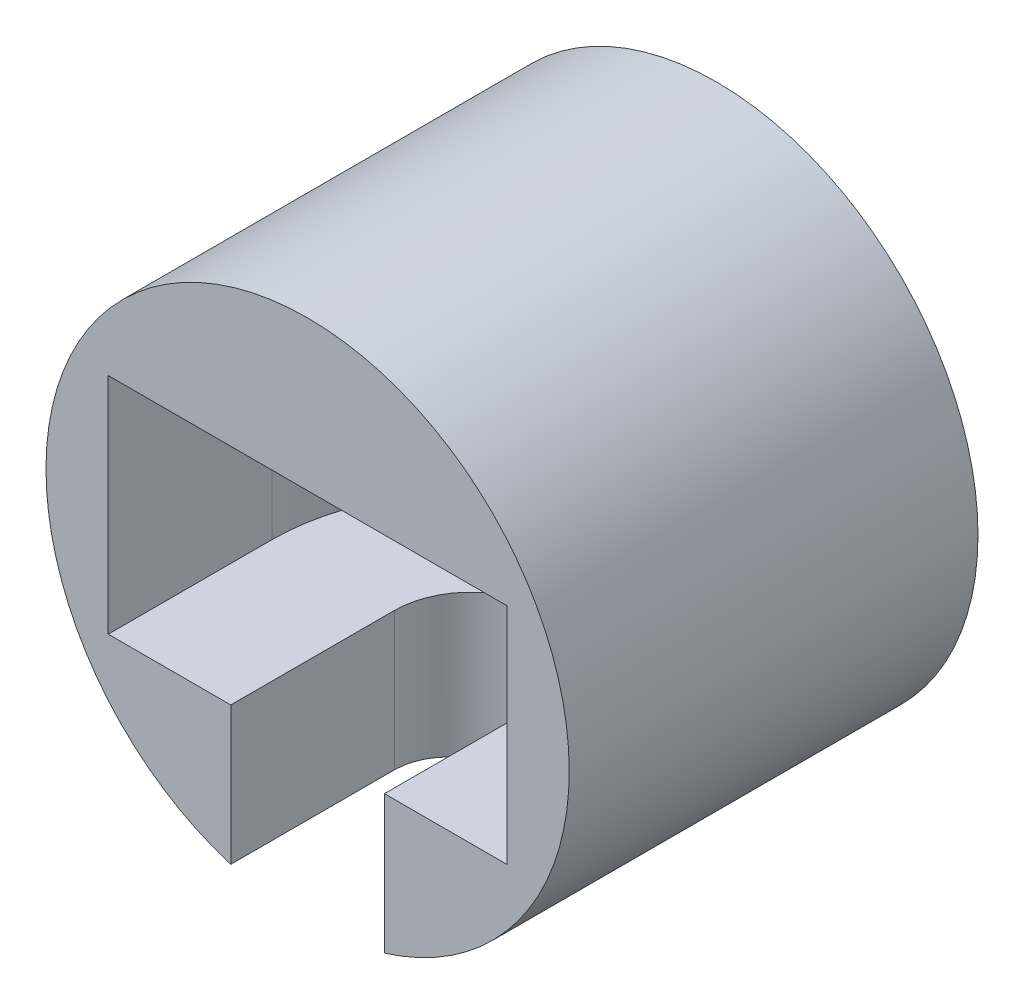
from build123d import *

# Parameters (mm, degrees)
SKETCH1_R               = 16
SKETCH1_R_2             = 3
BOSS_EXTRUDE1_DEPTH     = 25
CUT_EXTRUDE1_DEPTH      = 6.85
CUT_EXTRUDE2_REACH      = 35.719
CUT_EXTRUDE2_END_RADIUS = 16


with BuildPart() as part:
    # Sketch1 → Boss-Extrude1 (new body)
    with BuildSketch(Plane.XY):
        Circle(SKETCH1_R)
        Circle(SKETCH1_R_2, mode=Mode.SUBTRACT)
    extrude(amount=BOSS_EXTRUDE1_DEPTH)

    # Sketch2 → Cut-Extrude1 (cut, symmetric)
    with BuildSketch(Plane(origin=(0, 0, 0), x_dir=(1, 0, 0), z_dir=(0, 1, 0))):
        with BuildLine():
            Line((-12.19297317, -25), (12.19297317, -25))
            Line((12.19297317, -25), (12.19297317, -15))
            ThreePointArc((12.19297317, -15), (0, -2.80702683), (-12.19297317, -15))
            Line((-12.19297317, -15), (-12.19297317, -25))
        make_face()
    extrude(amount=CUT_EXTRUDE1_DEPTH, both=True, mode=Mode.SUBTRACT)

    # Cut-Extrude2: up to this cylinder (the profile starts inside it)
    cut_extrude2_end = Plane(origin=(0, 0, 18.114127), z_dir=(0, 0, -1)) * Cylinder(CUT_EXTRUDE2_END_RADIUS, 104.438, mode=Mode.PRIVATE)
    # Sketch3 → Cut-Extrude2 (cut, up to the surface)
    with BuildSketch(Plane(origin=(0, 0, 0), x_dir=(1, 0, 0), z_dir=(0, 1, 0)), mode=Mode.PRIVATE) as cut_extrude2_sk1:
        with BuildLine():
            Line((-4.7, -15), (-4.7, -25))
            Line((-4.7, -25), (4.7, -25))
            Line((4.7, -25), (4.7, -15))
            ThreePointArc((4.7, -15), (0, -10.3), (-4.7, -15))
        make_face()
    cut_extrude2_tool1 = extrude(cut_extrude2_sk1.sketch, amount=-CUT_EXTRUDE2_REACH, mode=Mode.PRIVATE) & cut_extrude2_end
    add(cut_extrude2_tool1.solids().sort_by_distance((0, 0, 18.114127))[0], mode=Mode.SUBTRACT)


solid = part.part
